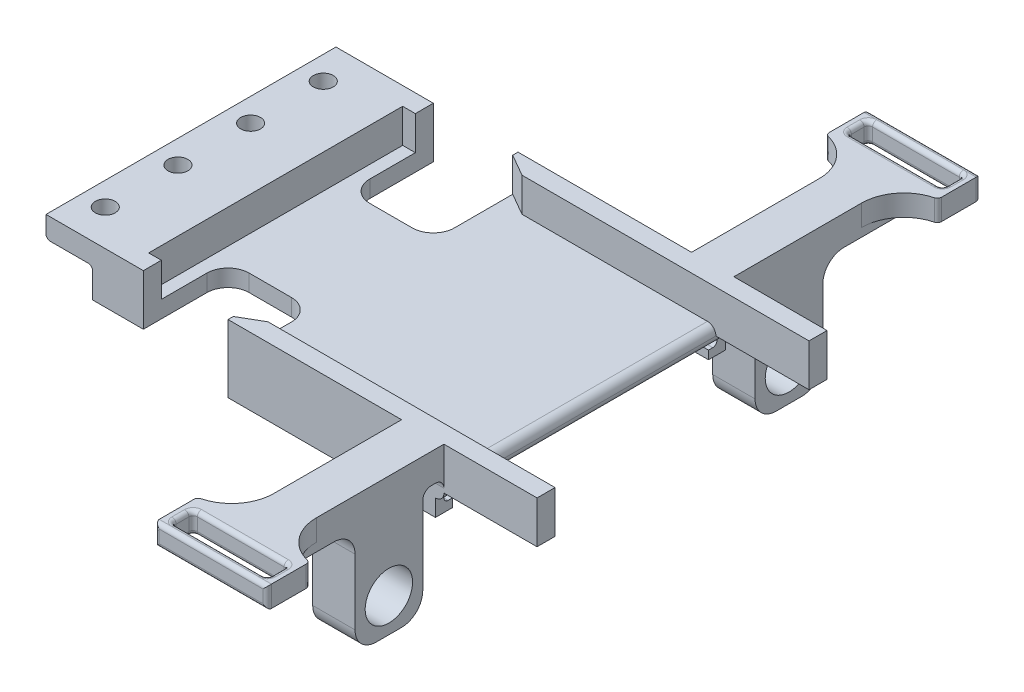
from build123d import *

# Parameters (mm, degrees)
SKETCH1_W                                       = 94
SKETCH1_H                                       = 68.5
BOSS_EXTRUDE1_DEPTH                             = 12
CUT_EXTRUDE1_REACH                              = 95.48
SKETCH3_W                                       = 11
SKETCH3_H                                       = 10
SKETCH4_W                                       = 60
SKETCH4_H                                       = 8
CUT_EXTRUDE2_DEPTH                              = 74
CUT_EXTRUDE3_REACH                              = 86.194
SKETCH5_R                                       = 2.35
SKETCH9_W                                       = 10
SKETCH9_H                                       = 7
BOSS_EXTRUDE2_DEPTH                             = 40
SKETCH10_W                                      = 10
SKETCH10_H                                      = 16
BOSS_EXTRUDE3_DEPTH                             = 25.5
CUT_EXTRUDE6_REACH                              = 137.921
SKETCH11_R                                      = 5.6
FILLET1_R                                       = 5
FILLET1_OF_MIRROR2_R                            = 5
FILLET2_R                                       = 2
FILLET3_R                                       = 1
SKETCH12_W                                      = 26.5
SKETCH12_H                                      = 10
SKETCH12_W_2                                    = 22.5
SKETCH12_H_2                                    = 5
BOSS_EXTRUDE4_DEPTH                             = 5
FILLET4_R                                       = 10
FILLET5_R                                       = 1
FILLET6_R                                       = 10
FILLET7_R                                       = 1
SKETCH13_W                                      = 20
SKETCH13_H                                      = 12
CUT_EXTRUDE7_DEPTH                              = 20
FILLET8_R                                       = 5
FILLET8_OF_MIRROR6_R                            = 5
CHAMFER3_SIZE                                   = 3
CHAMFER3_SIZE2                                  = 5.196152423
CHAMFER4_SIZE                                   = 3
CHAMFER4_SIZE2                                  = 5.196152423
FILLET9_R                                       = 2
SKETCH14_W                                      = 4.25
SKETCH14_H                                      = 10
BOSS_EXTRUDE5_DEPTH                             = 22
SKETCH15_W                                      = 49
SKETCH15_H                                      = 2
BOSS_EXTRUDE6_DEPTH                             = 4
SKETCH16_W                                      = 49
SKETCH16_H                                      = 2
BOSS_EXTRUDE7_DEPTH                             = 2
FILLET10_R                                      = 1
FILLET10_OF_MIRROR8_R                           = 1
CSK_FOR_M3_FLAT_HEAD_MACHINE_SCREW3_D           = 3.4
CSK_FOR_M3_FLAT_HEAD_MACHINE_SCREW3_DEPTH       = 5
CSK_FOR_M3_FLAT_HEAD_MACHINE_SCREW3_CSINK_D     = 6.3
CSK_FOR_M3_FLAT_HEAD_MACHINE_SCREW3_CSINK_ANGLE = 90


# Some blends are built 0.0001 mm under size
with BuildPart() as part:
    # Sketch1 → Boss-Extrude1 (new body)
    with BuildSketch(Plane(origin=(0, 0, 0), x_dir=(1, 0, 0), z_dir=(0, 1, 0))):
        with Locations((-15.468085106, -21.762300532)):
            Rectangle(SKETCH1_W, SKETCH1_H)
    extrude(amount=BOSS_EXTRUDE1_DEPTH)

    # Sketch3 → Cut-Extrude1 (cut, up to next)
    with BuildSketch(Plane.XY.offset(56.012300532), mode=Mode.PRIVATE) as cut_extrude1_sk1:
        with Locations((-56.968085106, 2)):
            Rectangle(SKETCH3_W, SKETCH3_H)
    cut_extrude1_tool1 = extrude(cut_extrude1_sk1.sketch, amount=-CUT_EXTRUDE1_REACH, mode=Mode.PRIVATE) & part.part
    add(cut_extrude1_tool1.solids().sort_by_distance((-56.968085, 2, 56.012301))[0], mode=Mode.SUBTRACT)

    # Sketch4 → Cut-Extrude2 (cut)
    with BuildSketch(Plane(origin=(31.531914894, 0, 0), x_dir=(0, 0, -1), z_dir=(1, 0, 0))):
        with Locations((-21.762300532, 8)):
            Rectangle(SKETCH4_W, SKETCH4_H)
    extrude(amount=-CUT_EXTRUDE2_DEPTH, mode=Mode.SUBTRACT)

    # Sketch5 → Cut-Extrude3 (cut, up to next)
    with BuildSketch(Plane.XZ.offset(-7), mode=Mode.PRIVATE) as cut_extrude3_sk1:
        with Locations(Location((-56.968085106, 47.512300532, 0), (0, 0, 270))):
            Circle(SKETCH5_R)
    cut_extrude3_tool1 = extrude(cut_extrude3_sk1.sketch, amount=-CUT_EXTRUDE3_REACH, mode=Mode.PRIVATE) & part.part
    # Sketch5 → Cut-Extrude3 (cut, up to next)
    with BuildSketch(Plane.XZ.offset(-7), mode=Mode.PRIVATE) as cut_extrude3_sk2:
        with Locations(Location((-56.968085106, 30.345633865, 0), (0, 0, 270))):
            Circle(SKETCH5_R)
    cut_extrude3_tool2 = extrude(cut_extrude3_sk2.sketch, amount=-CUT_EXTRUDE3_REACH, mode=Mode.PRIVATE) & part.part
    # Sketch5 → Cut-Extrude3 (cut, up to next)
    with BuildSketch(Plane.XZ.offset(-7), mode=Mode.PRIVATE) as cut_extrude3_sk3:
        with Locations(Location((-56.968085106, 13.178967199, 0), (0, 0, 270))):
            Circle(SKETCH5_R)
    cut_extrude3_tool3 = extrude(cut_extrude3_sk3.sketch, amount=-CUT_EXTRUDE3_REACH, mode=Mode.PRIVATE) & part.part
    # Sketch5 → Cut-Extrude3 (cut, up to next)
    with BuildSketch(Plane.XZ.offset(-7), mode=Mode.PRIVATE) as cut_extrude3_sk4:
        with Locations(Location((-56.968085106, -3.987699468, 0), (0, 0, 270))):
            Circle(SKETCH5_R)
    cut_extrude3_tool4 = extrude(cut_extrude3_sk4.sketch, amount=-CUT_EXTRUDE3_REACH, mode=Mode.PRIVATE) & part.part
    add(cut_extrude3_tool1.solids().sort_by_distance((-56.968085, 7, 47.512301))[0], mode=Mode.SUBTRACT)
    add(cut_extrude3_tool2.solids().sort_by_distance((-56.968085, 7, 30.345634))[0], mode=Mode.SUBTRACT)
    add(cut_extrude3_tool3.solids().sort_by_distance((-56.968085, 7, 13.178967))[0], mode=Mode.SUBTRACT)
    add(cut_extrude3_tool4.solids().sort_by_distance((-56.968085, 7, -3.987699))[0], mode=Mode.SUBTRACT)

    # Sketch9 → Boss-Extrude2 (add)
    with BuildSketch(Plane.XY.offset(56.012300532)):
        with Locations((26.531914894, 8.5)):
            Rectangle(SKETCH9_W, SKETCH9_H)
    boss_extrude2 = extrude(amount=BOSS_EXTRUDE2_DEPTH)

    # Sketch10 → Boss-Extrude3 (add)
    with BuildSketch(Plane.XZ.offset(-5)):
        with Locations((26.531914894, 69.012300532)):
            Rectangle(SKETCH10_W, SKETCH10_H)
    boss_extrude3 = extrude(amount=BOSS_EXTRUDE3_DEPTH)

    # Sketch11 → Cut-Extrude6 (cut, up to next)
    with BuildSketch(Plane(origin=(31.531914894, 0, 0), x_dir=(0, 0, -1), z_dir=(1, 0, 0)), mode=Mode.PRIVATE) as cut_extrude6_sk1:
        with Locations((-69.012300532, -12.5)):
            Circle(SKETCH11_R)
    cut_extrude6_tool1 = extrude(cut_extrude6_sk1.sketch, amount=-CUT_EXTRUDE6_REACH, mode=Mode.PRIVATE) & part.part
    cut_extrude6 = cut_extrude6_tool1.solids().sort_by_distance((31.531915, -12.5, 69.012301))[0]
    add(cut_extrude6, mode=Mode.SUBTRACT)

    # Fillet1
    fillet1_edges = [part.edges().sort_by_distance(p)[0] for p in [
        (26.531914894, 5, 77.012300532),
        (26.531914894, -20.5, 77.012300532),
        (26.531914894, -20.5, 61.012300532),
    ]]
    fillet(fillet1_edges, radius=FILLET1_R)

    # Mirror2: Boss-Extrude2, Boss-Extrude3, Cut-Extrude6 across plane
    add(boss_extrude2.mirror(Plane.XY.offset(21.762300532)))
    add(boss_extrude3.mirror(Plane.XY.offset(21.762300532)))
    add(cut_extrude6.mirror(Plane.XY.offset(21.762300532)), mode=Mode.SUBTRACT)

    # Fillet1 of Mirror2
    fillet1_of_mirror2_edges = [part.edges().sort_by_distance(p)[0] for p in [
        (26.531914894, 5, -33.487699468),
        (26.531914894, -20.5, -33.487699468),
        (26.531914894, -20.5, -17.487699468),
    ]]
    fillet(fillet1_of_mirror2_edges, radius=FILLET1_OF_MIRROR2_R)

    # Fillet2
    fillet2_edges = [part.edges().sort_by_distance(p)[0] for p in [
        (26.531914894, 5, -12.487699468),
        (26.531914894, 5, -17.487699468),
        (26.531914894, 5, 56.012300532),
        (26.531914894, 5, 61.012300532),
    ]]
    fillet(fillet2_edges, radius=FILLET2_R)

    # Fillet3
    fillet3_edges = [part.edges().sort_by_distance(p)[0] for p in [
        (-62.468085106, 7, 21.762300532),
        (-51.468085106, 7, 21.762300532),
    ]]
    fillet(fillet3_edges, radius=FILLET3_R)

    # Sketch12 → Boss-Extrude4 (add)
    with BuildSketch(Plane(origin=(0, 12, 0), x_dir=(1, 0, 0), z_dir=(0, 1, 0))):
        with Locations((26.531914894, -101.012300532)):
            Rectangle(SKETCH12_W, SKETCH12_H)
        with Locations((26.531914894, -101.512300532)):
            Rectangle(SKETCH12_W_2, SKETCH12_H_2, mode=Mode.SUBTRACT)
    boss_extrude4 = extrude(amount=-BOSS_EXTRUDE4_DEPTH)

    # Fillet4
    # the kernel refuses this fillet: 10 mm, written as the material it adds along each edge
    with BuildSketch(Plane(origin=(21.531914894, 12, 96.012300532), x_dir=(0, 0, -1), z_dir=(0, -1, 0)), Plane(origin=(31.531914894, 7, 96.012300532), x_dir=(0, 0, -1), z_dir=(0, 1, 0))) as fillet4_piece_1:
        with BuildLine():
            CenterArc((9.845684334, -10), FILLET4_R, 90, 79.921341892)
            Line((0, -8.25), (0, 0))
            Line((0, 0), (9.845684334, 0))
        make_face()
    extrude(amount=5)

    # Fillet5
    fillet5_edges = [part.edges().sort_by_distance(p)[0] for p in [
        (13.281914894, 9.5, 106.012300532),
        (13.281914894, 9.5, 96.012300532),
        (39.781914894, 9.5, 96.012300532),
        (26.531914894, 7, 106.012300532),
        (39.781914894, 9.5, 106.012300532),
        (26.531914894, 7, 99.012300532),
        (15.281914894, 7, 101.512300532),
        (26.531914894, 7, 104.012300532),
        (37.781914894, 7, 101.512300532),
        (26.531914894, 12, 106.012300532),
        (15.281914894, 12, 101.512300532),
        (15.281914894, 9.5, 99.012300532),
        (26.531914894, 12, 99.012300532),
        (37.781914894, 9.5, 99.012300532),
        (37.781914894, 12, 101.512300532),
        (37.781914894, 9.5, 104.012300532),
        (26.531914894, 12, 104.012300532),
        (15.281914894, 9.5, 104.012300532),
    ]]
    fillet(fillet5_edges, radius=FILLET5_R - 0.0001)  # a hair under: the kernel refuses the full size

    # Mirror4: Boss-Extrude4 across plane
    add(boss_extrude4.mirror(Plane.XY.offset(21.762300532)))

    # Fillet6
    # the kernel refuses this fillet: 10 mm, written as the material it adds along each edge
    with BuildSketch(Plane(origin=(21.531914894, 12, -52.487699468), x_dir=(0, 0, 1), z_dir=(0, -1, 0)), Plane(origin=(31.531914894, 7, -52.487699468), x_dir=(0, 0, 1), z_dir=(0, 1, 0))) as fillet6_piece_1:
        with BuildLine():
            CenterArc((9.845684334, 10), FILLET6_R, 190.078658108, 79.921341892)
            Line((0, 8.25), (0, 0))
            Line((0, 0), (9.845684334, 0))
        make_face()
    extrude(amount=5)

    # Fillet7
    fillet7_edges = [part.edges().sort_by_distance(p)[0] for p in [
        (39.781914894, 9.5, -52.487699468),
        (26.531914894, 7, -62.487699468),
        (26.531914894, 12, -55.487699468),
        (15.281914894, 12, -57.987699468),
        (26.531914894, 12, -60.487699468),
        (37.781914894, 12, -57.987699468),
        (13.281914894, 9.5, -52.487699468),
        (26.531914894, 12, -62.487699468),
        (13.281914894, 9.5, -62.487699468),
        (39.781914894, 9.5, -62.487699468),
        (15.281914894, 7, -57.987699468),
        (15.281914894, 9.5, -60.487699468),
        (26.531914894, 7, -60.487699468),
        (37.781914894, 9.5, -60.487699468),
        (37.781914894, 7, -57.987699468),
        (37.781914894, 9.5, -55.487699468),
        (26.531914894, 7, -55.487699468),
        (15.281914894, 9.5, -55.487699468),
    ]]
    fillet(fillet7_edges, radius=FILLET7_R - 0.0001)  # a hair under: the kernel refuses the full size

    # Sketch13 → Cut-Extrude7 (cut)
    with BuildSketch(Plane.XY.offset(56.012300532)):
        with Locations((-29.468085106, 6)):
            Rectangle(SKETCH13_W, SKETCH13_H)
    cut_extrude7 = extrude(amount=-CUT_EXTRUDE7_DEPTH, mode=Mode.SUBTRACT)

    # Fillet8
    fillet8_edges = [part.edges().sort_by_distance(p)[0] for p in [
        (-39.468085106, 2, 36.012300532),
        (-19.468085106, 2, 36.012300532),
    ]]
    fillet(fillet8_edges, radius=FILLET8_R)

    # Mirror6: Cut-Extrude7 across plane
    add(cut_extrude7.mirror(Plane.XY.offset(21.762300532)), mode=Mode.SUBTRACT)

    # Fillet8 of Mirror6
    fillet8_of_mirror6_edges = [part.edges().sort_by_distance(p)[0] for p in [
        (-39.468085106, 2, 7.512300532),
        (-19.468085106, 2, 7.512300532),
    ]]
    fillet(fillet8_of_mirror6_edges, radius=FILLET8_OF_MIRROR6_R)

    # Chamfer3
    chamfer3_edges = [part.edges().sort_by_distance(p)[0] for p in [
        (-19.468085106, 8, 51.762300532),
    ]]
    chamfer3_side = [part.faces().sort_by_distance(p)[0] for p in [
        (-19.468085106, 0.192093727, 48.512300532),
    ]]
    chamfer(chamfer3_edges, length=CHAMFER3_SIZE, length2=CHAMFER3_SIZE2, reference=chamfer3_side[0])

    # Chamfer4
    chamfer4_edges = [part.edges().sort_by_distance(p)[0] for p in [
        (-19.468085106, 8, -8.237699468),
    ]]
    chamfer4_side = [part.faces().sort_by_distance(p)[0] for p in [
        (-19.468085106, 0.192093727, -4.987699468),
    ]]
    chamfer(chamfer4_edges, length=CHAMFER4_SIZE, length2=CHAMFER4_SIZE2, reference=chamfer4_side[0])

    # Fillet9
    fillet9_edges = [part.edges().sort_by_distance(p)[0] for p in [
        (31.531914894, 4, 21.762300532),
        (31.531914894, 0, 21.762300532),
    ]]
    fillet(fillet9_edges, radius=FILLET9_R - 0.0001)  # a hair under: the kernel refuses the full size

    # Sketch14 → Boss-Extrude5 (add)
    with BuildSketch(Plane(origin=(31.531914894, 0, 0), x_dir=(0, 0, -1), z_dir=(1, 0, 0))):
        with Locations((-53.887300532, 7)):
            Rectangle(SKETCH14_W, SKETCH14_H)
    boss_extrude5 = extrude(amount=BOSS_EXTRUDE5_DEPTH)

    # Mirror7: Boss-Extrude5 across plane
    add(boss_extrude5.mirror(Plane.XY.offset(21.762300532)))

    # Sketch15 → Boss-Extrude6 (add)
    with BuildSketch(Plane.XZ):
        with Locations((5.031914894, 55.012300532)):
            Rectangle(SKETCH15_W, SKETCH15_H)
    boss_extrude6 = extrude(amount=BOSS_EXTRUDE6_DEPTH)

    # Sketch16 → Boss-Extrude7 (add)
    with BuildSketch(Plane(origin=(0, 0, 54.012300532), x_dir=(-1, 0, 0), z_dir=(0, 0, -1))):
        with Locations((-5.031914894, -3)):
            Rectangle(SKETCH16_W, SKETCH16_H)
    boss_extrude7 = extrude(amount=BOSS_EXTRUDE7_DEPTH)

    # Fillet10
    fillet10_edges = [part.edges().sort_by_distance(p)[0] for p in [
        (5.031914894, -2, 54.012300532),
    ]]
    fillet(fillet10_edges, radius=FILLET10_R)

    # Mirror8: Boss-Extrude6, Boss-Extrude7 across plane
    add(boss_extrude6.mirror(Plane.XY.offset(21.762300532)))
    add(boss_extrude7.mirror(Plane.XY.offset(21.762300532)))

    # Fillet10 of Mirror8
    fillet10_of_mirror8_edges = [part.edges().sort_by_distance(p)[0] for p in [
        (5.031914894, -2, -10.487699468),
    ]]
    fillet(fillet10_of_mirror8_edges, radius=FILLET10_OF_MIRROR8_R)

    # CSK for M3 Flat Head Machine Screw3
    with Locations(Plane(origin=(0, 7, 0), x_dir=(-1, 0, 0), z_dir=(0, -1, 0))):
        with Locations((56.968085106, 3.987699468), (56.968085106, -13.178967199), (56.968085106, -30.345633865), (56.968085106, -47.512300532)):
            CounterSinkHole(CSK_FOR_M3_FLAT_HEAD_MACHINE_SCREW3_D / 2, CSK_FOR_M3_FLAT_HEAD_MACHINE_SCREW3_CSINK_D / 2, depth=CSK_FOR_M3_FLAT_HEAD_MACHINE_SCREW3_DEPTH, counter_sink_angle=CSK_FOR_M3_FLAT_HEAD_MACHINE_SCREW3_CSINK_ANGLE)


solid = part.part
